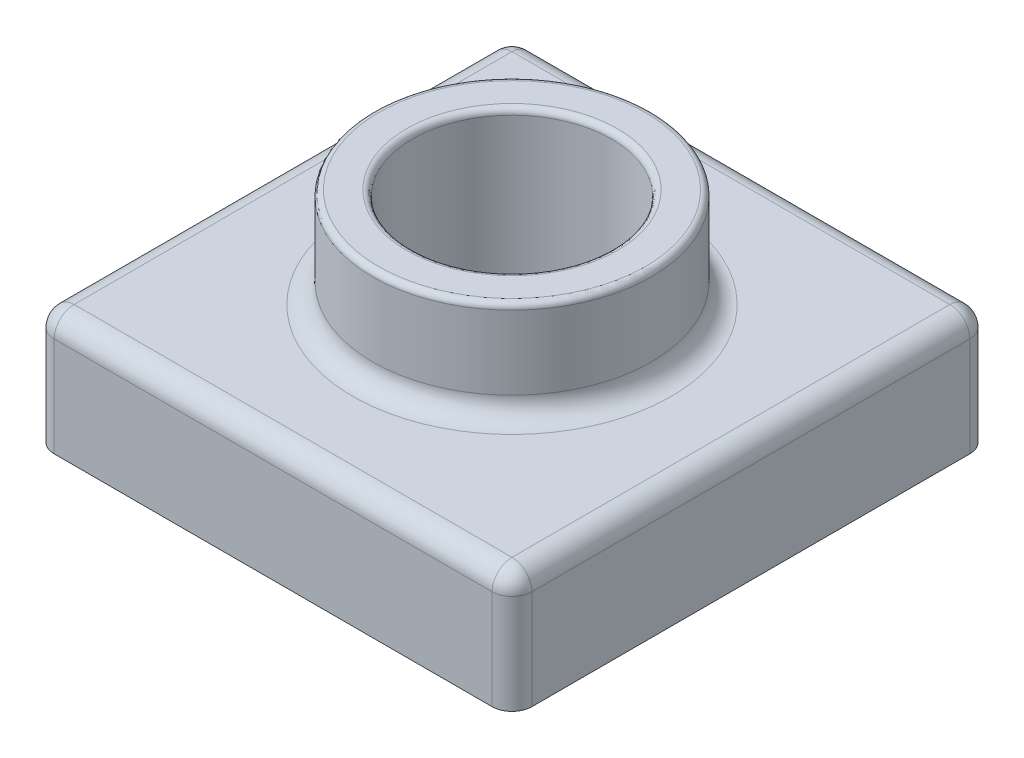
from build123d import *

# Parameters (mm, degrees)
SKETCH1_W           = 3048
SKETCH1_H           = 3048
BOSS_EXTRUDE1_DEPTH = 762
SKETCH2_R           = 889
BOSS_EXTRUDE2_DEPTH = 635
CUT_EXTRUDE2_DEPTH  = 2990.224983169
FILLET1_R           = 127
FILLET2_R           = 38.1
SHELL1_T            = -2


with BuildPart() as part:
    # Sketch1 → Boss-Extrude1 (new body)
    with BuildSketch(Plane(origin=(0, 0, 0), x_dir=(1, 0, 0), z_dir=(0, 1, 0))):
        with Locations((1524, 1524)):
            Rectangle(SKETCH1_W, SKETCH1_H)
    extrude(amount=BOSS_EXTRUDE1_DEPTH)

    # Sketch2 → Boss-Extrude2 (add)
    with BuildSketch(Plane(origin=(0, 762, 0), x_dir=(1, 0, 0), z_dir=(0, 1, 0))):
        with Locations(Location((1524, 1524, 0), (0, 0, 90))):
            Circle(SKETCH2_R)
    extrude(amount=BOSS_EXTRUDE2_DEPTH)

    # 3DSketch1 → Cut-Extrude2 (cut, through all)
    with BuildSketch(Plane(origin=(1524, 1397, -889), x_dir=(0.014693279213064564, 0, -0.9998920479461605), z_dir=(0, 1, 0))):
        with BuildLine():
            add(Edge.make_bspline(
                [(0, 0), (0.234679964, -15.967291249), (1.910015446, -47.886699357), (8.022956065, -95.438597065), (17.703395504, -142.394469581), (30.897066612, -188.488317653), (51.213249394, -243.432051138), (81.681356769, -305.742218352), (125.559722366, -372.634118305), (170.577182141, -425.40049618), (212.881538398, -465.920882057), (249.905600924, -496.383048357), (289.119373297, -523.965868005), (330.301920349, -548.514573513), (376.788184097, -571.669595091), (428.81519614, -592.282694793), (486.384371817, -609.018646836), (545.274687034, -620.259795783), (604.961637168, -625.905329135), (664.915060245, -625.904295155), (724.60190798, -620.257592549), (783.491856878, -609.015727028), (841.061544068, -592.278277677), (896.798943497, -570.193137092), (950.208919455, -542.957499193), (1000.81701536, -510.813664098), (1048.173356316, -474.046993132), (1091.856394529, -432.983587341), (1131.478447764, -387.989160988), (1166.687673323, -339.463745576), (1197.170943748, -287.838351177), (1222.656473517, -233.571428516), (1242.918553171, -177.145781568), (1257.777433676, -119.062916836), (1267.100770103, -59.838880157), (1270.804760419, 0), (1268.857409469, 59.921726691), (1261.276339996, 119.393845293), (1248.128601274, 177.887845748), (1229.530159839, 234.883539435), (1205.647234322, 289.874551192), (1176.692340957, 342.37235739), (1142.922494074, 391.910308137), (1104.637120408, 438.04750881), (1062.177277032, 480.374417582), (1015.920487538, 518.515142921), (966.277587249, 552.130520066), (913.689355202, 580.920951533), (858.623722172, 604.631322273), (801.570134941, 623.051236142), (743.035447958, 636.016704105), (683.539903117, 643.411581195), (623.612136545, 645.170970248), (563.786042875, 641.279878486), (508.532581076, 632.404923813), (458.139101406, 619.850046333), (412.622477981, 604.787572549), (368.37194417, 586.337040343), (325.636674807, 564.601780237), (275.571033561, 534.18810225), (220.208382717, 492.404862272), (162.903335266, 436.583997056), (119.68204653, 382.336590767), (87.965350963, 333.086066573), (65.11643608, 290.935785212), (45.511312891, 247.184294519), (29.260055954, 202.079461429), (17.222791899, 158.653424621), (8.775259106, 117.342004905), (3.295761167, 78.439716921), (0.233146572, 39.273638936), (-0.192358015, 13.087766015), (0, 0)],
                knots=[0, 0, 0, 0, 0.012009373, 0.024018899, 0.03602834, 0.04803776, 0.060047212, 0.080054517, 0.100061821, 0.120069126, 0.132078572, 0.144088007, 0.156097458, 0.168106893, 0.180116339, 0.195126146, 0.210135939, 0.225145733, 0.24015554, 0.255165346, 0.27017514, 0.285184934, 0.30019474, 0.315204547, 0.330214341, 0.345224134, 0.360233941, 0.375243748, 0.390253542, 0.405263335, 0.420273142, 0.435282949, 0.450292742, 0.465302536, 0.480312343, 0.49532215, 0.510331943, 0.525341737, 0.540351544, 0.55536135, 0.570371144, 0.585380938, 0.600390745, 0.615400551, 0.630410345, 0.645420139, 0.660429945, 0.675439752, 0.690449546, 0.705459339, 0.720469146, 0.735478953, 0.750488747, 0.76549854, 0.780508347, 0.792517792, 0.804527228, 0.816536679, 0.828546114, 0.840555559, 0.860562864, 0.880570169, 0.900577474, 0.912586918, 0.924596357, 0.936605811, 0.948615223, 0.960624687, 0.970468805, 0.980312764, 0.990156385, 1, 1, 1, 1], degree=3))
        make_face()
    extrude(amount=-CUT_EXTRUDE2_DEPTH, mode=Mode.SUBTRACT)

    # Fillet1
    fillet1_edges = [part.edges().sort_by_distance(p)[0] for p in [
        (3048, 762, -1524),
        (1524, 762, -635),
        (1524, 762, -3048),
        (0, 762, -1524),
        (0, 381, -3048),
        (3048, 381, -3048),
        (3048, 381, 0),
        (0, 381, 0),
        (1524, 762, 0),
    ]]
    fillet(fillet1_edges, radius=FILLET1_R)

    # Fillet2
    fillet2_edges = [part.edges().sort_by_distance(p)[0] for p in [
        (1523.999997333, 1397, -2158.999582411),
        (1524, 1397, -635),
    ]]
    fillet(fillet2_edges, radius=FILLET2_R)

    # Shell1
    shell1_openings = [part.faces().sort_by_distance(p)[0] for p in [
        (1524, 0, -43.105229384),
    ]]
    offset(amount=SHELL1_T, openings=shell1_openings, kind=Kind.INTERSECTION)


solid = part.part
